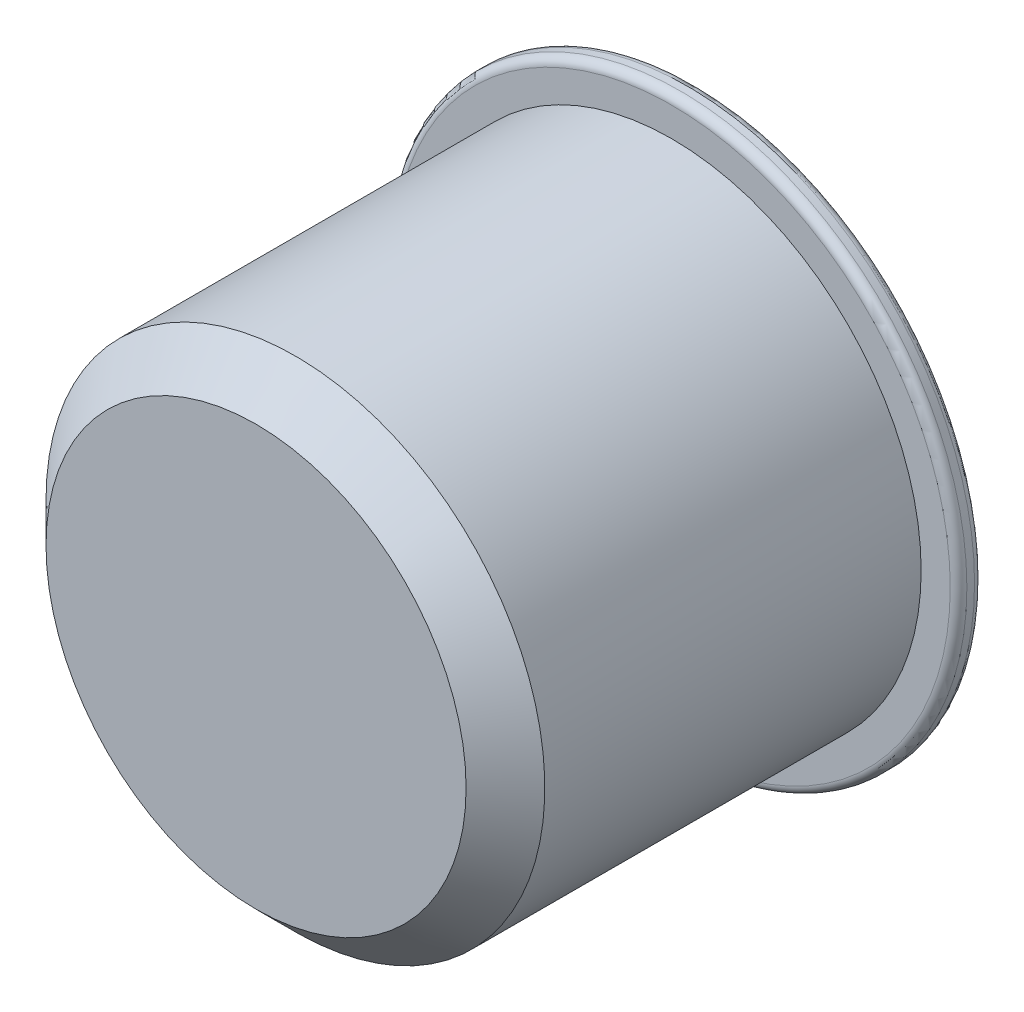
from build123d import *

# Parameters (mm, degrees)
SKETCH_2_R          = 6.9
EXTRUDE_1_DEPTH     = 1.6
SKETCH_4_R          = 6
EXTRUDE_2_DEPTH     = 10
SKETCH_7_R          = 4.5
SKETCH_7_R_2        = 3.5
CUT_EXTRUDE_1_DEPTH = 0.5
CUT_EXTRUDE_2_DEPTH = 0.2
CHAMFER_1_SIZE      = 0.1
FILLET_1_R          = 0.2


# Read off the part's stored shape, not the designer's step: M12 机械螺纹 螺柱1
with BuildPart() as part:
    # 草图2 → 凸台-拉伸1 (new body)
    with BuildSketch(Plane.XY):
        Circle(SKETCH_2_R)
    extrude(amount=EXTRUDE_1_DEPTH)

    # 草图3 → 切除-旋转1 (revolve, cut)
    with BuildSketch(Plane(origin=(0, 0, 0), x_dir=(1, 0, 0), z_dir=(0, 1, 0))):
        Polygon((-6.9, -1.1), (-5, 0), (-6.9, 0), align=None)
    revolve(axis=Axis((0, 0, -2.565533084), (0, 0, 1)), mode=Mode.SUBTRACT)

    # 草图4 → 凸台-拉伸2 (add)
    with BuildSketch(Plane.XY.offset(1.6)):
        Circle(SKETCH_4_R)
    extrude(amount=EXTRUDE_2_DEPTH)

    # M12 机械螺纹 螺柱1 outline → M12 机械螺纹 螺柱1 (revolve, cut)
    with BuildSketch(Plane.XZ):
        Polygon((6, 11.6), (5.053, 11.6), (6, 10.653), align=None)
    revolve(axis=Axis((0, 0, 0), (0, 0, 1)), mode=Mode.SUBTRACT)

    # 草图7 → 切除-拉伸1 (cut)
    with BuildSketch(Plane(origin=(0, 0, 0), x_dir=(-1, 0, 0), z_dir=(0, 0, -1))):
        Circle(SKETCH_7_R)
        Circle(SKETCH_7_R_2, mode=Mode.SUBTRACT)
    extrude(amount=-CUT_EXTRUDE_1_DEPTH, mode=Mode.SUBTRACT)

    # 草图8 → 切除-拉伸2 (cut)
    with BuildSketch(Plane(origin=(0, 0, 0), x_dir=(-1, 0, 0), z_dir=(0, 0, -1))):
        with BuildLine():
            Line((1.320582444, 1.833045199), (1.379254836, 1.91448589))
            ThreePointArc((1.379254836, 1.91448589), (1.517822019, 1.996168929), (1.671723162, 1.949399054))
            ThreePointArc((1.671723162, 1.949399054), (0, -2.568037189), (-1.671723162, 1.949399054))
            ThreePointArc((-1.671723162, 1.949399054), (-1.517822019, 1.996168929), (-1.379254836, 1.91448589))
            Line((-1.379254836, 1.91448589), (-1.320582444, 1.833045199))
            ThreePointArc((-1.320582444, 1.833045199), (-1.284222156, 1.69280287), (-1.352094962, 1.564805747))
            ThreePointArc((-1.352094962, 1.564805747), (0, -2.068037189), (1.352094962, 1.564805747))
            ThreePointArc((1.352094962, 1.564805747), (1.284222156, 1.69280287), (1.320582444, 1.833045199))
        make_face()
        with BuildLine():
            Line((-0.050187239, 1.280793561), (0.050187239, 1.280793561))
            ThreePointArc((0.050187239, 1.280793561), (0.191608596, 1.339372204), (0.250187239, 1.480793561))
            Line((0.250187239, 1.480793561), (0.250187239, 2.558804723))
            ThreePointArc((0.250187239, 2.558804723), (0.191608596, 2.70022608), (0.050187239, 2.758804723))
            Line((0.050187239, 2.758804723), (-0.050187239, 2.758804723))
            ThreePointArc((-0.050187239, 2.758804723), (-0.191608596, 2.70022608), (-0.250187239, 2.558804723))
            Line((-0.250187239, 2.558804723), (-0.250187239, 1.480793561))
            ThreePointArc((-0.250187239, 1.480793561), (-0.191608596, 1.339372204), (-0.050187239, 1.280793561))
        make_face()
    extrude(amount=-CUT_EXTRUDE_2_DEPTH, mode=Mode.SUBTRACT)

    # 倒角1
    chamfer_1_edges = [part.edges().sort_by_distance(p)[0] for p in [
        (4.5, 0, 0),
        (3.5, 0, 0),
    ]]
    chamfer(chamfer_1_edges, length=CHAMFER_1_SIZE)

    # 圆角1
    fillet_1_edges = [part.edges().sort_by_distance(p)[0] for p in [
        (-6.9, 0, 1.6),
        (0, 6.9, 1.1),
    ]]
    fillet(fillet_1_edges, radius=FILLET_1_R)


solid = part.part
